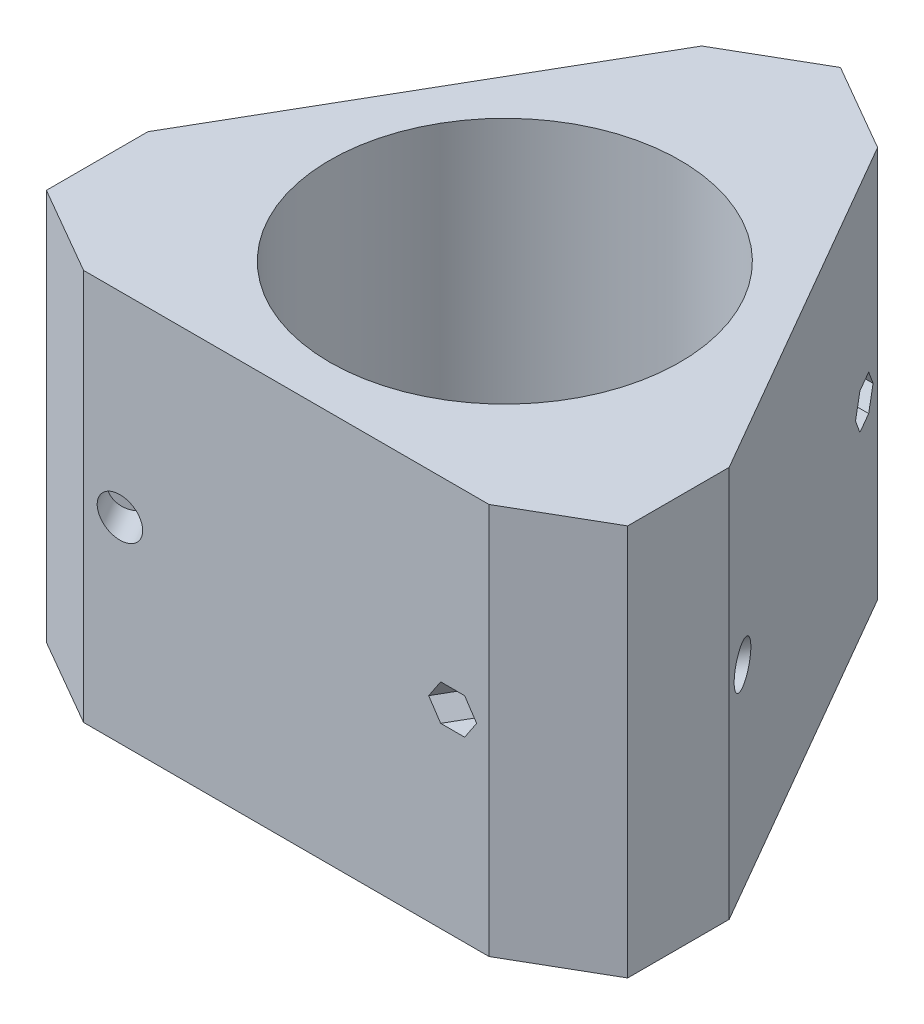
from build123d import *

# Parameters (mm, degrees)
BOSS_EXTRUDE1_DEPTH = 57.15
CUT_EXTRUDE1_START  = -16.000000004
SKETCH3_R           = 3.499999985
CUT_EXTRUDE1_DEPTH  = 105.568182472
CIRPATTERN1_COUNT   = 3


with BuildPart() as part:
    # Sketch1 → Boss-Extrude1 (new, symmetric)
    with BuildSketch(Plane(origin=(0, 0, 0), x_dir=(1, 0, 0), z_dir=(0, 1, 0))):
        with BuildLine():
            Line((-44.258055055, -25.5524), (-84.849935901, -48.988133333))
            Line((-84.849935901, -48.988133333), (-59.186716436, -63.8048))
            Line((-59.186716436, -63.8048), (59.186716436, -63.8048))
            Line((59.186716436, -63.8048), (84.849935901, -48.988133333))
            Line((84.849935901, -48.988133333), (44.258055055, -25.5524))
            ThreePointArc((44.258055055, -25.5524), (0, -51.1048), (-44.258055055, -25.5524))
        make_face()
    boss_extrude1 = extrude(amount=BOSS_EXTRUDE1_DEPTH, both=True)

    # Sketch2 → Cut-Revolve7 (revolve, cut)
    with BuildSketch(Plane(origin=(0, 0, 0), x_dir=(1, 0, 0), z_dir=(0, 1, 0))):
        Polygon((-43.878504985, -64.929800036), (-61.024306886, -35.232400008), (-64.055395786, -36.9824), (-46.909593885, -66.679800029), align=None)
    cut_revolve7 = revolve(axis=Axis((-64.055395786, 0, 36.9824), (0.4999999999999998, 0, 0.8660254037844388)), mode=Mode.SUBTRACT)

    # Sketch2<7> → Cut-Revolve8 (revolve, cut)
    with BuildSketch(Plane(origin=(0, 0, 0), x_dir=(1, 0, 0), z_dir=(0, 1, 0))):
        Polygon((-44.528024059, -63.8048), (-41.929947764, -63.8048), (-49.075749726, -51.427907942), (-51.024306947, -52.552907978), align=None)
    cut_revolve8 = revolve(axis=Axis((-64.055395786, 0, 36.9824), (0.4999999999999998, 0, 0.8660254037844388)), mode=Mode.SUBTRACT)

    # Mirror1: Cut-Revolve7 across plane
    add(cut_revolve7.mirror(Plane(origin=(0, 0, 0), x_dir=(0, 0, 1), z_dir=(1, 0, 0))), mode=Mode.SUBTRACT)

    # Sketch3 → Cut-Extrude1 (cut, through all)
    with BuildSketch(Plane(origin=(0, 0, 0), x_dir=(-0.8660254037844386, 0, -0.5000000000000001), z_dir=(0.5000000000000001, 0, -0.8660254037844386)).offset(CUT_EXTRUDE1_START)):
        Polygon((-76.995888937, 5.250000041), (-80.026977874, 0), (-76.995888937, -5.250000041), (-70.933711063, -5.250000041), (-67.902622126, 0), (-70.933711063, 5.250000041), align=None)
        with Locations((-73.9648, 0)):
            Circle(SKETCH3_R, mode=Mode.SUBTRACT)
    cut_extrude1 = extrude(amount=-CUT_EXTRUDE1_DEPTH, mode=Mode.SUBTRACT)

    # CirPattern1: Boss-Extrude1, Cut-Revolve7, Cut-Revolve8, Cut-Extrude1 ×3 about axis
    cirpattern1_axis = Axis((0, 57.15, 0), (0, -1, 0))
    add([boss_extrude1.rotate(cirpattern1_axis, i * 360 / CIRPATTERN1_COUNT) for i in range(1, CIRPATTERN1_COUNT)])
    add([cut_revolve7.rotate(cirpattern1_axis, i * 360 / CIRPATTERN1_COUNT) for i in range(1, CIRPATTERN1_COUNT)], mode=Mode.SUBTRACT)
    add([cut_revolve8.rotate(cirpattern1_axis, i * 360 / CIRPATTERN1_COUNT) for i in range(1, CIRPATTERN1_COUNT)], mode=Mode.SUBTRACT)
    add([cut_extrude1.rotate(cirpattern1_axis, i * 360 / CIRPATTERN1_COUNT) for i in range(1, CIRPATTERN1_COUNT)], mode=Mode.SUBTRACT)

    # CirPattern1 copy 1 sketch → CirPattern1 copy 1 (revolve, cut)
    with BuildSketch(Plane(origin=(0, 0, 0), x_dir=(0.4999999999999998, 0, -0.8660254037844387), z_dir=(0, 1, 0))):
        Polygon((-43.878504985, 64.929800036), (-61.024306886, 35.232400008), (-64.055395786, 36.9824), (-46.909593885, 66.679800029), align=None)
    revolve(axis=Axis((-64.055395786, 0, 36.9824), (0.5000000000000004, 0, 0.8660254037844384)), mode=Mode.SUBTRACT)

    # CirPattern1 copy 2 sketch → CirPattern1 copy 2 (revolve, cut)
    with BuildSketch(Plane(origin=(0, 0, 0), x_dir=(0.5000000000000004, 0, 0.8660254037844384), z_dir=(0, 1, 0))):
        Polygon((-43.878504985, 64.929800036), (-61.024306886, 35.232400008), (-64.055395786, 36.9824), (-46.909593885, 66.679800029), align=None)
    revolve(axis=Axis((0, 0, -73.9648), (-1, 0, 0)), mode=Mode.SUBTRACT)


solid = part.part
